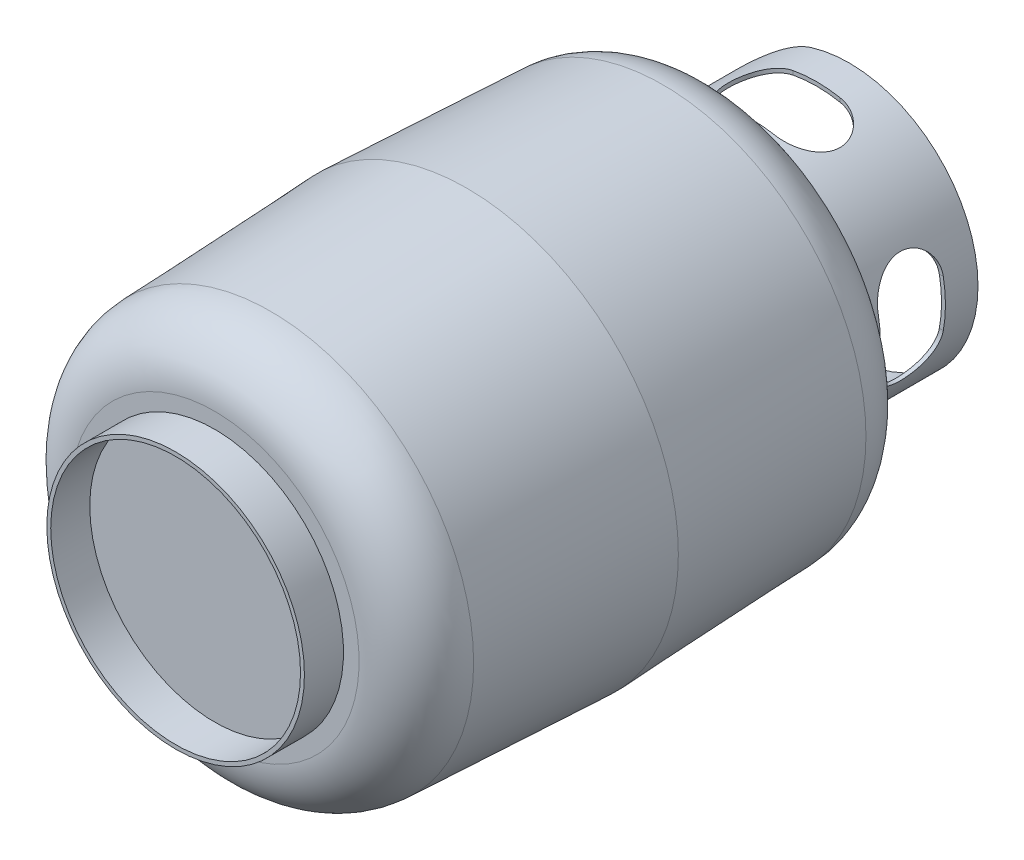
from build123d import *

# Parameters (mm, degrees)
SKETCH5_R           = 98.96256391
SKETCH5_R_2         = 95.96256391
BOSS_EXTRUDE1_DEPTH = 30
BOSS_EXTRUDE2_START = 100
BOSS_EXTRUDE2_DEPTH = 100
FILLET1_R           = 30
CUT_EXTRUDE3_DEPTH  = 155
CUT_EXTRUDE4_DEPTH  = 155


with BuildPart() as part:
    # Sketch1 → Revolve2 (revolve)
    with BuildSketch(Plane(origin=(0, 0, 0), x_dir=(1, 0, 0), z_dir=(0, 1, 0)), mode=Mode.PRIVATE) as revolve2_sk:
        with BuildLine():
            Line((0, -193.75), (110.96256391, -193.75))
            ThreePointArc((110.96256391, -193.75), (142.08065142, -181.256378293), (155.919733881, -150.712872431))
            Line((155.919733881, -150.712872431), (162.5, 0))
            Line((162.5, 0), (155.919733881, 150.712872431))
            ThreePointArc((155.919733881, 150.712872431), (142.08065142, 181.256378293), (110.96256391, 193.75))
            Line((110.96256391, 193.75), (37, 193.75))
            ThreePointArc((37, 193.75), (28.514718626, 197.264718626), (25, 205.75))
            Line((25, 205.75), (25, 213.75))
            Line((25, 213.75), (21, 213.75))
            Line((21, 213.75), (21, 205.75))
            ThreePointArc((21, 205.75), (25.686291501, 194.436291501), (37, 189.75))
            Line((37, 189.75), (110.96256391, 189.75))
            ThreePointArc((110.96256391, 189.75), (139.314599197, 178.366922444), (151.923540995, 150.538394882))
            Line((151.923540995, 150.538394882), (158.496189259, 0))
            Line((158.496189259, 0), (151.923540995, -150.538394882))
            ThreePointArc((151.923540995, -150.538394882), (139.314599197, -178.366922444), (110.96256391, -189.75))
            Line((110.96256391, -189.75), (0, -189.75))
            Line((0, -189.75), (0, -193.75))
        make_face()
    revolve(revolve2_sk.sketch.rotate(Axis((0, 0, -288.058740368), (0, 0, 1)), 180), axis=Axis((0, 0, -288.058740368), (0, 0, 1)))

    # Sketch5 → Boss-Extrude1 (add)
    with BuildSketch(Plane.XY.offset(193.75)):
        with Locations(Location((0, 0, 0), (0, 0, 180))):
            Circle(SKETCH5_R)
        Circle(SKETCH5_R_2, mode=Mode.SUBTRACT)
    extrude(amount=BOSS_EXTRUDE1_DEPTH)

    # Sketch6 → Boss-Extrude2 (add)
    with BuildSketch(Plane(origin=(0, 0, -193.75), x_dir=(-1, 0, 0), z_dir=(0, 0, -1)).offset(BOSS_EXTRUDE2_START)):
        with BuildLine():
            Line((56.76259474, 81.065386535), (55.041865431, 78.607930402))
            ThreePointArc((55.041865431, 78.607930402), (-95.96256391, 0), (55.041865431, -78.607930402))
            Line((55.041865431, -78.607930402), (56.76259474, -81.065386535))
            ThreePointArc((56.76259474, -81.065386535), (-98.96256391, 0), (56.76259474, 81.065386535))
        make_face()
    extrude(amount=-BOSS_EXTRUDE2_DEPTH)

    # Fillet1
    # the kernel refuses this fillet: 30 mm, written as the material it takes off along each edge
    with BuildSketch(Plane(origin=(-99.780827466, 142.501789857, -293.75), x_dir=(0, 0, 1), z_dir=(0.573576436351045, -0.8191520442889927, 0)), Plane(origin=(-12.023632704, -17.17152708, -293.75), x_dir=(0, 0, 1), z_dir=(-0.573576436351045, -0.8191520442889927, 0))) as fillet1_piece_1:
        with BuildLine():
            CenterArc((FILLET1_R, -FILLET1_R), FILLET1_R, 90, 90)
            Line((0, -FILLET1_R), (0, 0))
            Line((0, 0), (FILLET1_R, 0))
        make_face()
    extrude(amount=153, mode=Mode.SUBTRACT)

    # Sketch7 → Cut-Extrude3 (cut, symmetric)
    with BuildSketch(Plane(origin=(0, 0, 0), x_dir=(1, 0, 0), z_dir=(0, 1, 0))):
        with BuildLine():
            Line((-18, 268.75), (18, 268.75))
            ThreePointArc((18, 268.75), (43, 243.75), (18, 218.75))
            Line((18, 218.75), (-18, 218.75))
            ThreePointArc((-18, 218.75), (-43, 243.75), (-18, 268.75))
        make_face()
    extrude(amount=CUT_EXTRUDE3_DEPTH, both=True, mode=Mode.SUBTRACT)

    # Sketch8 → Cut-Extrude4 (cut, symmetric)
    with BuildSketch(Plane(origin=(0, 0, 0), x_dir=(0, 0, -1), z_dir=(1, 0, 0))):
        with BuildLine():
            Line((268.75, 18), (268.75, -18))
            ThreePointArc((268.75, -18), (243.75, -43), (218.75, -18))
            Line((218.75, -18), (218.75, 18))
            ThreePointArc((218.75, 18), (243.75, 43), (268.75, 18))
        make_face()
    extrude(amount=CUT_EXTRUDE4_DEPTH, both=True, mode=Mode.SUBTRACT)


solid = part.part
